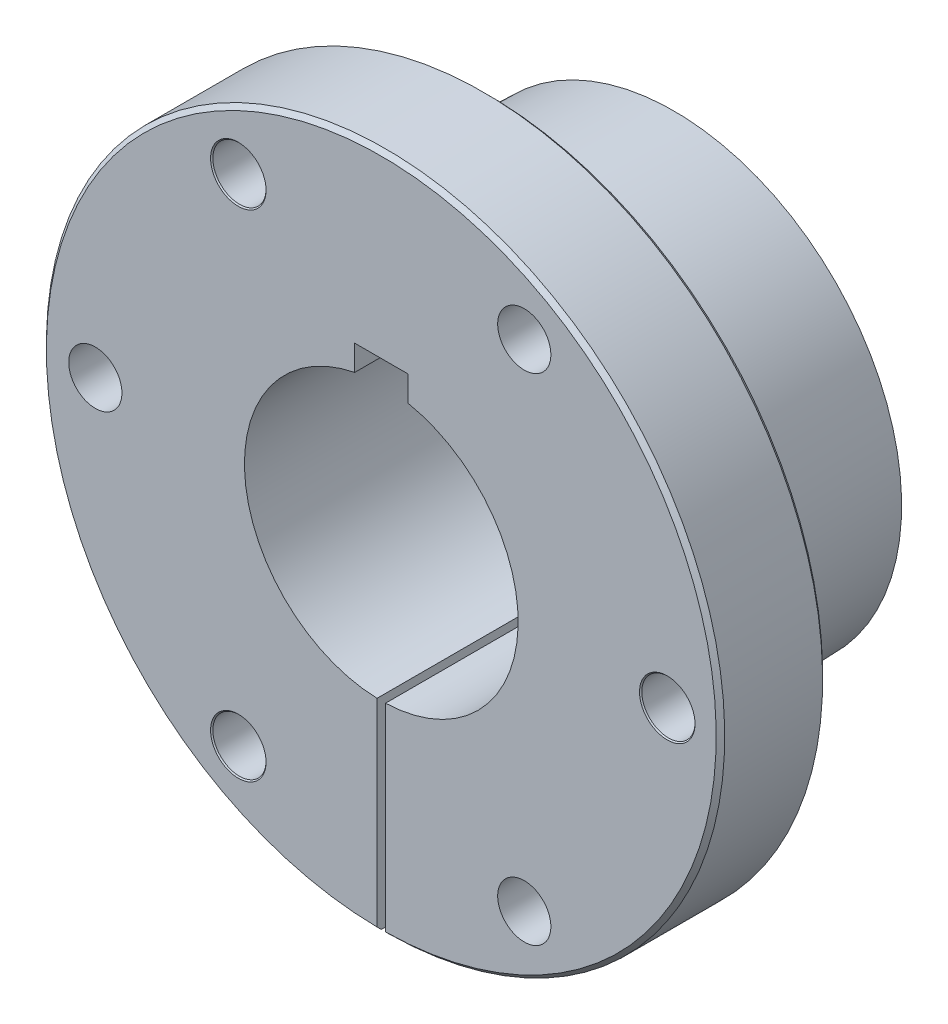
from build123d import *

# Parameters (mm, degrees)
SKETCH3_W           = 1.016
SKETCH3_H           = 40.48125
CUT_EXTRUDE1_DEPTH  = 68.06130649
CUT_EXTRUDE2_REACH  = 69.061
SKETCH4_R           = 3.175
CIRPATTERN1_COUNT   = 3
SKETCH16_W          = 6.35
SKETCH16_H          = 6.35
CUT_EXTRUDE7_DEPTH  = 68.06130649
SKETCH24_R          = 16.335149264
CUT_EXTRUDE13_DEPTH = 68.06130649


# Read off the part's stored shape, not the designer's step: Cut-Extrude3, Cut-Extrude4
with BuildPart() as part:
    # Sketch1 → Revolve1 (revolve)
    with BuildSketch(Plane(origin=(0, 0, 0), x_dir=(0, 0, -1), z_dir=(1, 0, 0)), mode=Mode.PRIVATE) as revolve1_sk:
        Polygon((34.925, -27.1795875), (15.875, -27.7749), (15.875, -26.98115), (12.7, -26.98115), (12.7, -39.97325), (12.192, -40.48125), (0.508, -40.48125), (0, -39.97325), (0, -15.875), (34.925, -15.875), align=None)
    revolve(revolve1_sk.sketch.rotate(Axis((0, 0, 0), (0, 0, -1)), 270), axis=Axis((0, 0, 0), (0, 0, -1)))

    # Sketch3 → Cut-Extrude1 (cut, through all)
    with BuildSketch(Plane.XY):
        with Locations((0, -20.240625)):
            Rectangle(SKETCH3_W, SKETCH3_H)
    extrude(amount=-CUT_EXTRUDE1_DEPTH, mode=Mode.SUBTRACT)

    # Sketch4 → Cut-Extrude2 (cut, up to next)
    with BuildSketch(Plane.XY, mode=Mode.PRIVATE) as cut_extrude2_sk1:
        with Locations((34.13125, 0)):
            Circle(SKETCH4_R)
    cut_extrude2_tool1 = extrude(cut_extrude2_sk1.sketch, amount=-CUT_EXTRUDE2_REACH, mode=Mode.PRIVATE) & part.part
    # Sketch4 → Cut-Extrude2 (cut, up to next)
    with BuildSketch(Plane.XY, mode=Mode.PRIVATE) as cut_extrude2_sk2:
        with Locations((-34.13125, 0)):
            Circle(SKETCH4_R)
    cut_extrude2_tool2 = extrude(cut_extrude2_sk2.sketch, amount=-CUT_EXTRUDE2_REACH, mode=Mode.PRIVATE) & part.part
    cut_extrude2_1 = cut_extrude2_tool1.solids().sort_by_distance((34.13125, 0, 0))[0]
    add(cut_extrude2_1, mode=Mode.SUBTRACT)
    cut_extrude2_2 = cut_extrude2_tool2.solids().sort_by_distance((-34.13125, 0, 0))[0]
    add(cut_extrude2_2, mode=Mode.SUBTRACT)
    cut_extrude2 = cut_extrude2_1 + cut_extrude2_2  # Cut-Extrude2 as one shape, for the pattern or mirror that repeats it

    # Cut-Extrude3 outline → Cut-Extrude3 (revolve, cut)
    with BuildSketch(Plane(origin=(34.13125, 0, 0), x_dir=(1, 0, 0), z_dir=(0, -1, 0))):
        Polygon((3.175, 0), (3.175, -0.137481533), (3.312481533, 0), align=None)
    cut_extrude3 = revolve(axis=Axis((34.13125, 0, 0), (0, 0, 1)), mode=Mode.SUBTRACT)

    # Cut-Extrude4 outline → Cut-Extrude4 (revolve, cut)
    with BuildSketch(Plane(origin=(34.13125, 0, 0), x_dir=(1, 0, 0), z_dir=(0, -1, 0))):
        Polygon((3.312481533, -12.7), (3.175, -12.562518467), (3.175, -12.7), align=None)
    cut_extrude4 = revolve(axis=Axis((34.13125, 0, 0), (0, 0, 1)), mode=Mode.SUBTRACT)

    # CirPattern1: Cut-Extrude2, Cut-Extrude3, Cut-Extrude4 ×3 about axis
    cirpattern1_axis = Axis((0, 0, 0), (0, 0, 1))
    add([cut_extrude2.rotate(cirpattern1_axis, i * 360 / CIRPATTERN1_COUNT) for i in range(1, CIRPATTERN1_COUNT)], mode=Mode.SUBTRACT)
    add([cut_extrude3.rotate(cirpattern1_axis, i * 360 / CIRPATTERN1_COUNT) for i in range(1, CIRPATTERN1_COUNT)], mode=Mode.SUBTRACT)
    add([cut_extrude4.rotate(cirpattern1_axis, i * 360 / CIRPATTERN1_COUNT) for i in range(1, CIRPATTERN1_COUNT)], mode=Mode.SUBTRACT)

    # Sketch16 → Cut-Extrude7 (cut, through all)
    with BuildSketch(Plane.XY):
        with Locations((0, 15.875)):
            Rectangle(SKETCH16_W, SKETCH16_H)
    extrude(amount=-CUT_EXTRUDE7_DEPTH, mode=Mode.SUBTRACT)

    # Sketch24 → Cut-Extrude13 (cut, through all)
    with BuildSketch(Plane.XY):
        Circle(SKETCH24_R)
    extrude(amount=-CUT_EXTRUDE13_DEPTH, mode=Mode.SUBTRACT)


solid = part.part
